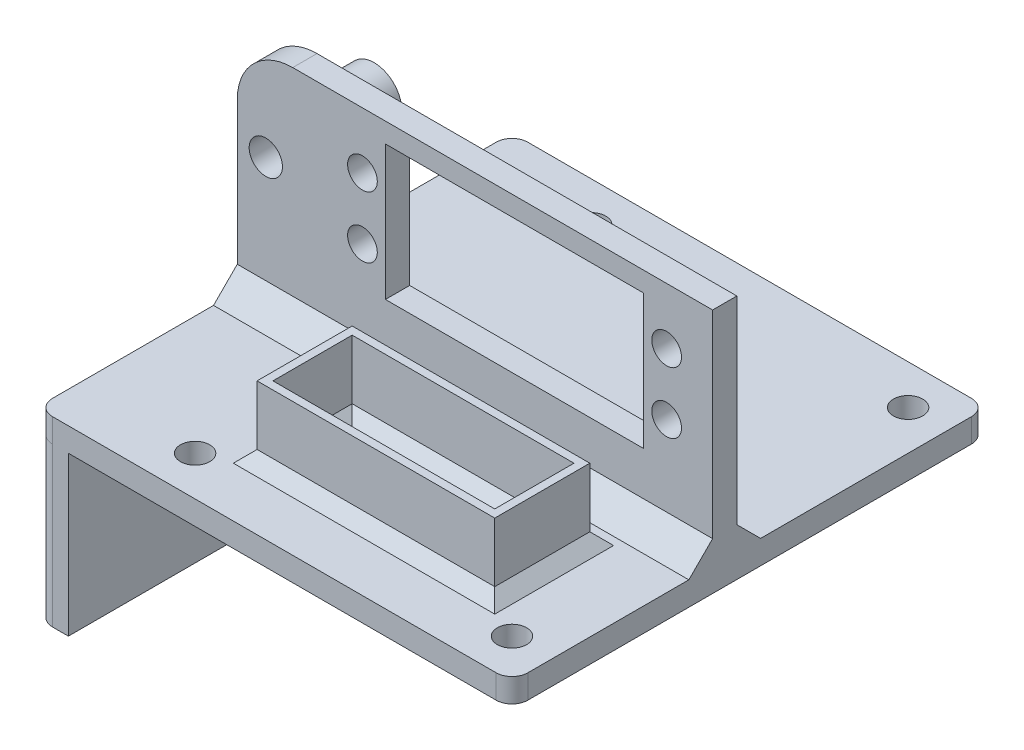
from build123d import *

# Parameters (mm, degrees)
SKETCH1_W            = 76.2
SKETCH1_H            = 35.56
BOSS_EXTRUDE1_DEPTH  = 1.905
SKETCH2_R            = 2.38125
CUT_EXTRUDE1_DEPTH   = 6.35
SKETCH3_W            = 41.402
SKETCH3_H            = 21.59
CUT_EXTRUDE2_DEPTH   = 3.81
SKETCH5_W            = 76.2
SKETCH5_H            = 76.2
BOSS_EXTRUDE2_DEPTH  = 3.81
SKETCH8_R            = 2.667
CUT_EXTRUDE5_DEPTH   = 3.81
BOSS_EXTRUDE4_START  = 6.096
SKETCH9_R            = 4.445
SKETCH9_R_2          = 2.667
BOSS_EXTRUDE4_DEPTH  = 6.096
SKETCH10_W           = 6.985
SKETCH10_H           = 18.205369343
BOSS_EXTRUDE5_DEPTH  = 6.096
SKETCH11_R           = 4.445
SKETCH11_R_2         = 2.667
BOSS_EXTRUDE6_DEPTH  = 5.08
SKETCH12_W           = 6.985
SKETCH12_H           = 18.205369343
BOSS_EXTRUDE7_DEPTH  = 5.08
SKETCH13_R           = 2.3495
CUT_EXTRUDE6_DEPTH   = 72.898153662
BOSS_EXTRUDE8_START  = 15.466000132
SKETCH14_R           = 2.38125
SKETCH14_R_2         = 2.667
SKETCH14_W           = 41.402
SKETCH14_H           = 21.59
BOSS_EXTRUDE8_DEPTH  = 15.466000132
CUT_EXTRUDE7_START   = -15.39000003
SKETCH15_R           = 2.38125
SKETCH15_W           = 41.402
SKETCH15_H           = 21.59
CUT_EXTRUDE7_DEPTH   = 15.39000003
CUT_EXTRUDE8_START   = -8.001
SKETCH16_R           = 2.667
CUT_EXTRUDE8_DEPTH   = 8.001
FILLET1_R            = 2.54
CHAMFER1_SIZE        = 3.81
FILLET2_R            = 8.89
SKETCH17_W           = 5.08
SKETCH17_H           = 25.4
BOSS_EXTRUDE9_DEPTH  = 76.2
SKETCH18_W           = 38.1
SKETCH18_H           = 15.24
SKETCH18_W_2         = 35.56
SKETCH18_H_2         = 12.7
BOSS_EXTRUDE10_DEPTH = 11.43
CHAMFER2_SIZE        = 1.905
FILLET3_R            = 2.54
SKETCH19_R           = 2.3495
CUT_EXTRUDE9_DEPTH   = 8.89
SKETCH20_W           = 6.985
SKETCH20_H           = 16.51
CUT_EXTRUDE10_DEPTH  = 1.27
FILLET4_R            = 2.54


with BuildPart() as part:
    # Sketch1 → Boss-Extrude1 (new, symmetric)
    with BuildSketch(Plane.XY):
        Rectangle(SKETCH1_W, SKETCH1_H)
    extrude(amount=BOSS_EXTRUDE1_DEPTH, both=True)

    # Sketch2 → Cut-Extrude1 (cut)
    with BuildSketch(Plane.XY.offset(1.905)):
        with Locations((-18.034, 8.734933)):
            Circle(SKETCH2_R)
        with Locations((30.734, 8.734933)):
            Circle(SKETCH2_R)
        with Locations((30.734, -1.114933)):
            Circle(SKETCH2_R)
        with Locations((-18.034, -1.114933)):
            Circle(SKETCH2_R)
    extrude(amount=-CUT_EXTRUDE1_DEPTH, mode=Mode.SUBTRACT)

    # Sketch3 → Cut-Extrude2 (cut)
    with BuildSketch(Plane.XY.offset(1.905)):
        with Locations((6.35, 3.81)):
            Rectangle(SKETCH3_W, SKETCH3_H)
    extrude(amount=-CUT_EXTRUDE2_DEPTH, mode=Mode.SUBTRACT)

    # Sketch5 → Boss-Extrude2 (add)
    with BuildSketch(Plane.XZ.offset(17.78)):
        with Locations((0, 11.43)):
            Rectangle(SKETCH5_W, SKETCH5_H)
    extrude(amount=BOSS_EXTRUDE2_DEPTH)

    # Sketch8 → Cut-Extrude5 (cut)
    with BuildSketch(Plane(origin=(0, 0, -1.905), x_dir=(-1, 0, 0), z_dir=(0, 0, -1))):
        with Locations((33.528, 3.175)):
            Circle(SKETCH8_R)
    extrude(amount=-CUT_EXTRUDE5_DEPTH, mode=Mode.SUBTRACT)

    # Sketch9 → Boss-Extrude4 (add)
    with BuildSketch(Plane(origin=(0, 0, -1.905), x_dir=(-1, 0, 0), z_dir=(0, 0, -1)).offset(BOSS_EXTRUDE4_START)):
        with Locations(Location((33.528, 3.175, 0), (0, 0, 180))):
            Circle(SKETCH9_R)
        with Locations((33.528, 3.175)):
            Circle(SKETCH9_R_2, mode=Mode.SUBTRACT)
    extrude(amount=-BOSS_EXTRUDE4_DEPTH)

    # Sketch10 → Boss-Extrude5 (add)
    with BuildSketch(Plane(origin=(0, 0, -1.905), x_dir=(-1, 0, 0), z_dir=(0, 0, -1))):
        with Locations((33.528, -8.677315329)):
            Rectangle(SKETCH10_W, SKETCH10_H)
    extrude(amount=BOSS_EXTRUDE5_DEPTH)

    # Sketch11 → Boss-Extrude6 (add)
    with BuildSketch(Plane.XY.offset(1.905)):
        with Locations(Location((-33.528, 3.175, 0), (0, 0, 180))):
            Circle(SKETCH11_R)
        with Locations(Location((-33.528, 3.175, 0), (0, 0, 180))):
            Circle(SKETCH11_R_2, mode=Mode.SUBTRACT)
    extrude(amount=BOSS_EXTRUDE6_DEPTH)

    # Sketch12 → Boss-Extrude7 (add)
    with BuildSketch(Plane.XY.offset(1.905)):
        with Locations((-33.528, -8.677315329)):
            Rectangle(SKETCH12_W, SKETCH12_H)
    extrude(amount=BOSS_EXTRUDE7_DEPTH)

    # Sketch13 → Cut-Extrude6 (cut, through all)
    with BuildSketch(Plane(origin=(0, -17.78, 0), x_dir=(1, 0, 0), z_dir=(0, 1, 0))):
        with Locations(Location((-19.05, 20.32, 0), (0, 0, 90))):
            Circle(SKETCH13_R)
        with Locations(Location((31.75, 20.32, 0), (0, 0, 90))):
            Circle(SKETCH13_R)
        with Locations(Location((31.75, -43.18, 0), (0, 0, 270))):
            Circle(SKETCH13_R)
        with Locations(Location((-19.05, -43.18, 0), (0, 0, 270))):
            Circle(SKETCH13_R)
    extrude(amount=-CUT_EXTRUDE6_DEPTH, mode=Mode.SUBTRACT)

    # Sketch14 → Boss-Extrude8 (add)
    with BuildSketch(Plane.XY.offset(1.905).offset(BOSS_EXTRUDE8_START)):
        Polygon((-30.0355, -17.78), (38.1, -17.78), (38.1, 17.78), (-38.1, 17.78), (-38.1, -17.78), (-37.0205, -17.78), align=None)
        with Locations((30.734, -1.114933)):
            Circle(SKETCH14_R, mode=Mode.SUBTRACT)
        with Locations((30.734, 8.734933)):
            Circle(SKETCH14_R, mode=Mode.SUBTRACT)
        with Locations((-18.034, -1.114933)):
            Circle(SKETCH14_R, mode=Mode.SUBTRACT)
        with Locations((-18.034, 8.734933)):
            Circle(SKETCH14_R, mode=Mode.SUBTRACT)
        with Locations(Location((-33.528, 3.175, 0), (0, 0, 180))):
            Circle(SKETCH14_R_2, mode=Mode.SUBTRACT)
        with Locations((6.35, 3.81)):
            Rectangle(SKETCH14_W, SKETCH14_H, mode=Mode.SUBTRACT)
    extrude(amount=-BOSS_EXTRUDE8_DEPTH)

    # Sketch15 → Cut-Extrude7 (cut)
    with BuildSketch(Plane(origin=(0, 0, -1.905), x_dir=(-1, 0, 0), z_dir=(0, 0, -1)).offset(CUT_EXTRUDE7_START)):
        with BuildLine():
            Line((-38.1, -17.78), (30.0355, -17.78))
            Line((30.0355, -17.78), (30.0355, 0.425369343))
            ThreePointArc((30.0355, 0.425369343), (33.528, 7.62), (37.0205, 0.425369343))
            Line((37.0205, 0.425369343), (37.0205, -17.78))
            Line((37.0205, -17.78), (38.1, -17.78))
            Line((38.1, -17.78), (38.1, 17.78))
            Line((38.1, 17.78), (-38.1, 17.78))
            Line((-38.1, 17.78), (-38.1, -17.78))
        make_face()
        with Locations(Location((18.034, -1.114933, 0), (0, 0, 180))):
            Circle(SKETCH15_R, mode=Mode.SUBTRACT)
        with Locations(Location((18.034, 8.734933, 0), (0, 0, 180))):
            Circle(SKETCH15_R, mode=Mode.SUBTRACT)
        with Locations(Location((-30.734, -1.114933, 0), (0, 0, 180))):
            Circle(SKETCH15_R, mode=Mode.SUBTRACT)
        with Locations(Location((-30.734, 8.734933, 0), (0, 0, 180))):
            Circle(SKETCH15_R, mode=Mode.SUBTRACT)
        with Locations((-6.35, 3.81)):
            Rectangle(SKETCH15_W, SKETCH15_H, mode=Mode.SUBTRACT)
    extrude(amount=CUT_EXTRUDE7_DEPTH, mode=Mode.SUBTRACT)

    # Sketch16 → Cut-Extrude8 (cut)
    with BuildSketch(Plane(origin=(0, 0, -8.001), x_dir=(-1, 0, 0), z_dir=(0, 0, -1)).offset(CUT_EXTRUDE8_START)):
        with BuildLine():
            Line((30.0355, 0.425369343), (30.0355, -17.78))
            Line((30.0355, -17.78), (37.0205, -17.78))
            Line((37.0205, -17.78), (37.0205, 0.425369343))
            ThreePointArc((37.0205, 0.425369343), (33.528, 7.62), (30.0355, 0.425369343))
        make_face()
        with Locations((33.528, 3.175)):
            Circle(SKETCH16_R, mode=Mode.SUBTRACT)
    extrude(amount=CUT_EXTRUDE8_DEPTH, mode=Mode.SUBTRACT)

    # Fillet1
    fillet1_edges = [part.edges().sort_by_distance(p)[0] for p in [
        (38.1, -19.685, -26.67),
        (38.1, -19.685, 49.53),
        (-38.1, -19.685, 49.53),
        (-38.1, -19.685, -26.67),
    ]]
    fillet(fillet1_edges, radius=FILLET1_R)

    # Chamfer1
    chamfer1_edges = [part.edges().sort_by_distance(p)[0] for p in [
        (0, -17.78, 17.371000132),
        (4.03225, -17.78, 13.48500003),
    ]]
    chamfer(chamfer1_edges, length=CHAMFER1_SIZE)

    # Fillet2
    fillet2_edges = [part.edges().sort_by_distance(p)[0] for p in [
        (-38.1, 17.78, 15.428000081),
    ]]
    fillet(fillet2_edges, radius=FILLET2_R)

    # Sketch17 → Boss-Extrude9 (add)
    with BuildSketch(Plane(origin=(0, 0, -26.67), x_dir=(-1, 0, 0), z_dir=(0, 0, -1))):
        with Locations((35.56, -34.29)):
            Rectangle(SKETCH17_W, SKETCH17_H)
    extrude(amount=-BOSS_EXTRUDE9_DEPTH)

    # Sketch18 → Boss-Extrude10 (add)
    with BuildSketch(Plane(origin=(0, -17.78, 0), x_dir=(1, 0, 0), z_dir=(0, 1, 0))):
        with Locations((6.35, -31.976000132)):
            Rectangle(SKETCH18_W, SKETCH18_H)
        with Locations((6.35, -31.976000132)):
            Rectangle(SKETCH18_W_2, SKETCH18_H_2, mode=Mode.SUBTRACT)
    extrude(amount=BOSS_EXTRUDE10_DEPTH)

    # Chamfer2
    chamfer2_edges = [part.edges().sort_by_distance(p)[0] for p in [
        (6.35, -17.78, 25.626000132),
        (24.13, -17.78, 31.976000132),
        (-12.7, -17.78, 31.976000132),
        (6.35, -17.78, 39.596000132),
        (25.4, -17.78, 31.976000132),
        (6.35, -17.78, 24.356000132),
        (-11.43, -17.78, 31.976000132),
        (6.35, -17.78, 38.326000132),
    ]]
    chamfer(chamfer2_edges, length=CHAMFER2_SIZE)

    # Fillet3
    fillet3_edges = [part.edges().sort_by_distance(p)[0] for p in [
        (-38.1, -34.29, 49.53),
        (-38.1, -34.29, -26.67),
    ]]
    fillet(fillet3_edges, radius=FILLET3_R)

    # Sketch19 → Cut-Extrude9 (cut)
    with BuildSketch(Plane.ZY.offset(38.1)):
        with Locations((-7.62, -32.385)):
            Circle(SKETCH19_R)
        with Locations(Location((30.48, -32.385, 0), (0, 0, 180))):
            Circle(SKETCH19_R)
    extrude(amount=-CUT_EXTRUDE9_DEPTH, mode=Mode.SUBTRACT)

    # Sketch20 → Cut-Extrude10 (cut)
    with BuildSketch(Plane(origin=(0, 0, 0), x_dir=(-1, 0, 0), z_dir=(0, 0, -1))):
        with Locations((33.528, -9.525)):
            Rectangle(SKETCH20_W, SKETCH20_H)
    extrude(amount=-CUT_EXTRUDE10_DEPTH, mode=Mode.SUBTRACT)

    # Fillet4
    # the kernel refuses this fillet: 2.54 mm, written as the material it adds along each edge
    with BuildSketch(Plane(origin=(-37.0205, -1.27, 1.27), x_dir=(0, -1, 0), z_dir=(1, 0, 0))) as fillet4_piece_1:
        with BuildLine():
            CenterArc((2.199704526, 2.54), FILLET4_R, 210, 60)
            Line((0, 1.27), (-0.043994091, 1.2446))
            ThreePointArc((-0.043994091, 1.2446), (-0.0508, 0.635), (-0.0508, 0))
            Line((-0.0508, 0), (0, -0.0508))
            Line((0, -0.0508), (2.199704526, -0.0508))
            Line((2.199704526, -0.0508), (2.199704526, 0))
        make_face()
    extrude(amount=6.985)


solid = part.part
